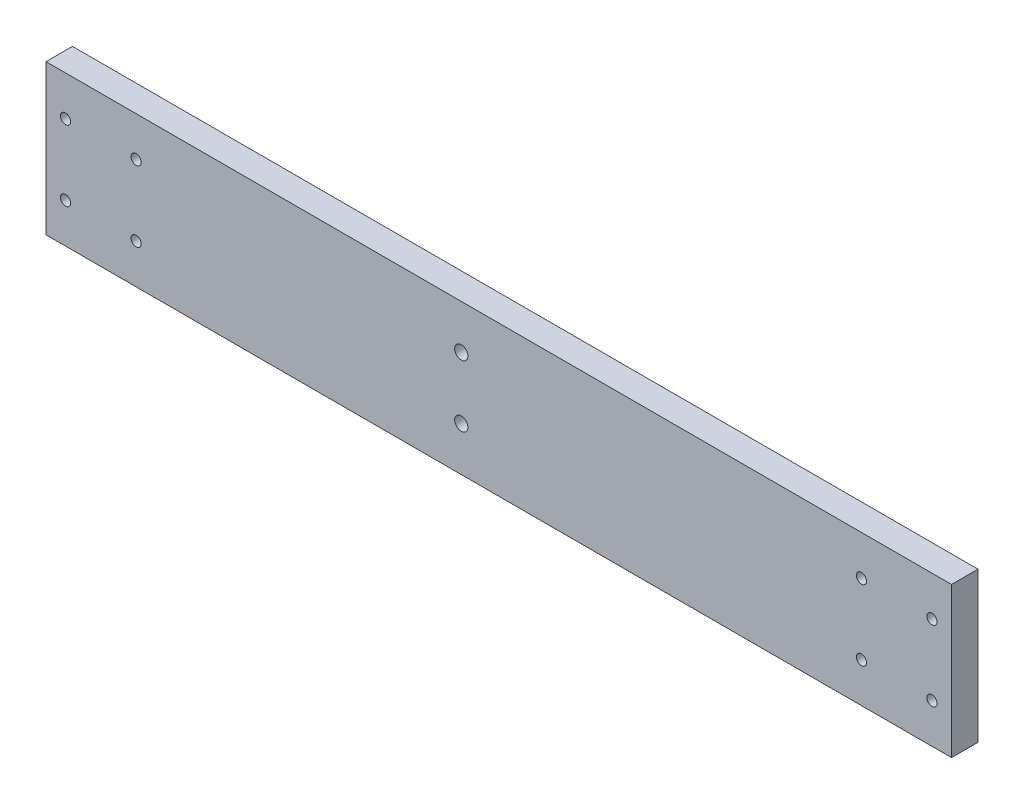
from build123d import *

# Parameters (mm, degrees)
ESQUISSE1_W             = 205.26
ESQUISSE1_H             = 34
BOSS_EXTRU_1_DEPTH      = 6
ESQUISSE2_R             = 1.15
ESQUISSE2_R_2           = 1.5
ENL_V_MAT_EXTRU_1_DEPTH = 6


with BuildPart() as part:
    # Esquisse1 → Boss.-Extru.1 (new body)
    with BuildSketch(Plane.XY):
        Rectangle(ESQUISSE1_W, ESQUISSE1_H)
    extrude(amount=BOSS_EXTRU_1_DEPTH)

    # Esquisse2 → Enlèv. mat.-Extru.1 (cut)
    with BuildSketch(Plane.XY.offset(6)):
        with Locations((-98.2, 8)):
            Circle(ESQUISSE2_R)
        with Locations((-82.2, 8)):
            Circle(ESQUISSE2_R)
        with Locations((-82.2, -8)):
            Circle(ESQUISSE2_R)
        with Locations((-98.2, -8)):
            Circle(ESQUISSE2_R)
        with Locations((98.2, -8)):
            Circle(ESQUISSE2_R)
        with Locations((82.2, -8)):
            Circle(ESQUISSE2_R)
        with Locations((82.2, 8)):
            Circle(ESQUISSE2_R)
        with Locations((98.2, 8)):
            Circle(ESQUISSE2_R)
        with Locations((-8.5, 7)):
            Circle(ESQUISSE2_R_2)
        with Locations((-8.5, -7)):
            Circle(ESQUISSE2_R_2)
    extrude(amount=-ENL_V_MAT_EXTRU_1_DEPTH, mode=Mode.SUBTRACT)


solid = part.part
